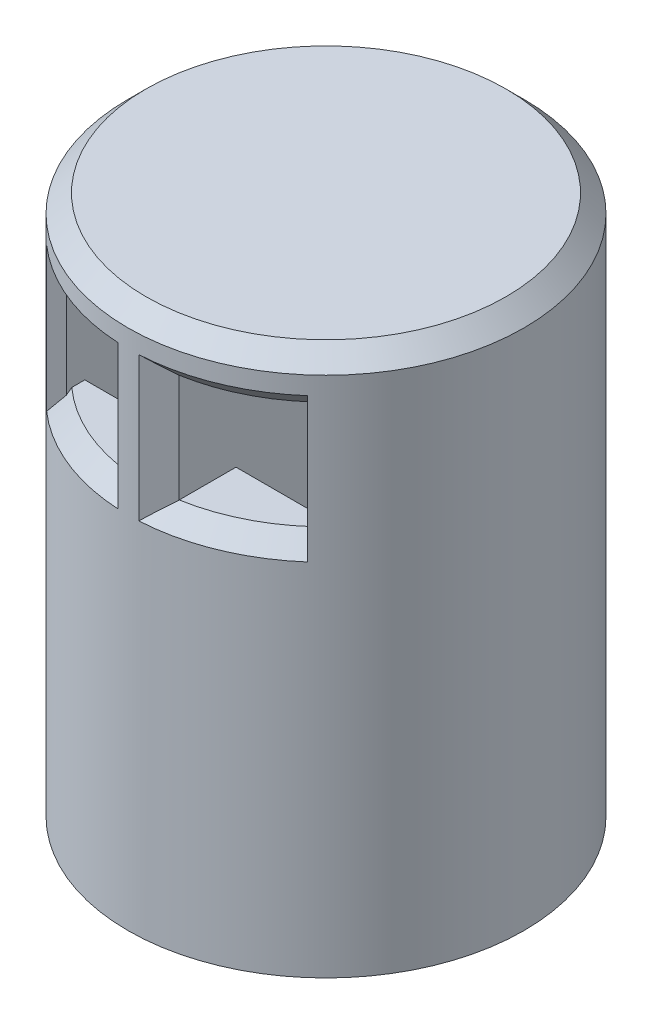
from build123d import *

# Parameters (mm, degrees)
SKETCH1_R           = 5.5
BOSS_EXTRUDE1_DEPTH = 15
SKETCH2_W           = 6.7
SKETCH2_H           = 6.7
CUT_EXTRUDE1_DEPTH  = 3.5
SKETCH3_W           = 2.5
SKETCH3_H           = 6.7
CUT_EXTRUDE2_DEPTH  = 10
SKETCH4_W           = 2.5
SKETCH4_H           = 3
CUT_EXTRUDE3_DEPTH  = 19.263967258
CHAMFER1_SIZE       = 0.5
CHAMFER2_SIZE       = 0.5


with BuildPart() as part:
    # Sketch1 → Boss-Extrude1 (new body)
    with BuildSketch(Plane(origin=(0, 0, 0), x_dir=(1, 0, 0), z_dir=(0, 1, 0))):
        with Locations(Location((0, 0, 0), (0, 0, 270))):
            Circle(SKETCH1_R)
    extrude(amount=BOSS_EXTRUDE1_DEPTH)

    # Sketch2 → Cut-Extrude1 (cut)
    with BuildSketch(Plane.XZ):
        Rectangle(SKETCH2_W, SKETCH2_H)
    extrude(amount=-CUT_EXTRUDE1_DEPTH, mode=Mode.SUBTRACT)

    # Sketch3 → Cut-Extrude2 (cut)
    with BuildSketch(Plane.XZ.offset(-3.5)):
        with Locations((-2.1, 0)):
            Rectangle(SKETCH3_W, SKETCH3_H)
        with Locations((2.1, 0)):
            Rectangle(SKETCH3_W, SKETCH3_H)
    extrude(amount=-CUT_EXTRUDE2_DEPTH, mode=Mode.SUBTRACT)

    # Sketch4 → Cut-Extrude3 (cut, through all)
    with BuildSketch(Plane(origin=(0, 0, 3.35), x_dir=(-1, 0, 0), z_dir=(0, 0, -1))):
        with Locations((2.1, 12)):
            Rectangle(SKETCH4_W, SKETCH4_H)
        with Locations((-2.1, 12)):
            Rectangle(SKETCH4_W, SKETCH4_H)
    extrude(amount=-CUT_EXTRUDE3_DEPTH, mode=Mode.SUBTRACT)

    # Chamfer1
    # the kernel refuses this chamfer: 0.599923048, 0.5, 0.35658472 mm, written as the material it takes off along each edge
    with BuildSketch(Plane(origin=(3.35, 0, -3.35), x_dir=(0, 1, 0), z_dir=(-1, 0, 0)), Plane(origin=(0.85, 3.5, 3.35), x_dir=(-1, 0, 0), z_dir=(0, 0, -1)), Plane(origin=(3.35, 0, 3.35), x_dir=(0, 1, 0), z_dir=(0, 0, -1)), Plane(origin=(-3.35, 0, 3.35), x_dir=(0, 1, 0), z_dir=(1, 0, 0)), Plane(origin=(-3.35, 0, -3.35), x_dir=(0, 1, 0), z_dir=(0, 0, 1))) as chamfer1_piece_1:
        Polygon((CHAMFER1_SIZE, 0), (0, CHAMFER1_SIZE), (0, 0), align=None)
    extrude(amount=6.7, mode=Mode.SUBTRACT)
    with BuildSketch(Plane(origin=(-0.85, 3.5, 3.35), x_dir=(1, 0, 0), z_dir=(0, 0, -1))) as chamfer1_piece_2:
        Polygon((CHAMFER1_SIZE, 0), (0, -CHAMFER1_SIZE), (0, 0), align=None)
    extrude(amount=6.7, mode=Mode.SUBTRACT)
    with BuildSketch(Plane(origin=(-3.35, 13.5, 4.362052269), x_dir=(-0.7730150093099369, 0, -0.6343877326852705), z_dir=(0, -1, 0))) as chamfer1_piece_3:
        with BuildLine():
            Line((0.355264336, 0), (CHAMFER1_SIZE * 0.634387732685, CHAMFER1_SIZE * 0.77301500931))
            Line((CHAMFER1_SIZE * 0.634387732685, CHAMFER1_SIZE * 0.77301500931), (0, 0))
            ThreePointArc((0, 0), (0.17861115, -0.002869133), (0.355264336, 0))
        make_face()
    extrude(amount=3, mode=Mode.SUBTRACT)
    with BuildSketch(Plane(origin=(-0.85, 13.5, 5.433921236), x_dir=(0.9945853784930031, 0, 0.10392268707038738), z_dir=(0, -1, 0))) as chamfer1_piece_4:
        with BuildLine():
            Line((0.561379751, 0), (-CHAMFER1_SIZE * 0.10392268707, -CHAMFER1_SIZE * 0.994585378493))
            Line((-CHAMFER1_SIZE * 0.10392268707, -CHAMFER1_SIZE * 0.994585378493), (0, 0))
            ThreePointArc((0, 0), (0.290009157, 0.007159211), (0.561379751, 0))
        make_face()
    extrude(amount=3, mode=Mode.SUBTRACT)
    with BuildSketch(Plane(origin=(0.85, 13.5, 5.433921236), x_dir=(-0.9945853784930031, 0, 0.10392268707038782), z_dir=(0, -1, 0))) as chamfer1_piece_5:
        with BuildLine():
            Line((0.561379751, 0), (-CHAMFER1_SIZE * 0.10392268707, CHAMFER1_SIZE * 0.994585378493))
            Line((-CHAMFER1_SIZE * 0.10392268707, CHAMFER1_SIZE * 0.994585378493), (0, 0))
            ThreePointArc((0, 0), (0.290009157, -0.007159211), (0.561379751, 0))
        make_face()
    extrude(amount=3, mode=Mode.SUBTRACT)
    with BuildSketch(Plane(origin=(3.35, 13.5, 4.362052269), x_dir=(0.7730150093099386, 0, -0.6343877326852684), z_dir=(0, -1, 0))) as chamfer1_piece_6:
        with BuildLine():
            Line((0.355264336, 0), (CHAMFER1_SIZE * 0.634387732685, -CHAMFER1_SIZE * 0.77301500931))
            Line((CHAMFER1_SIZE * 0.634387732685, -CHAMFER1_SIZE * 0.77301500931), (0, 0))
            ThreePointArc((0, 0), (0.17861115, 0.002869133), (0.355264336, 0))
        make_face()
    extrude(amount=3, mode=Mode.SUBTRACT)
    with BuildSketch(Plane(origin=(4.635841494, 0, -3.35), x_dir=(0, 1, 0), z_dir=(-1, 0, 0))) as chamfer1_piece_7a_section:
        Polygon((CHAMFER1_SIZE, 0), (0, CHAMFER1_SIZE), (0, 0), align=None)
    chamfer1_piece_7a = extrude(amount=7.985841494, mode=Mode.PRIVATE)
    chamfer1_piece_7a = chamfer1_piece_7a & Plane(origin=(0, 0, 0), x_dir=(0, 0, 1), z_dir=(0, -1, 0)) * Cylinder(5.5, 18, mode=Mode.PRIVATE)
    chamfer1_piece_7a = split(chamfer1_piece_7a, bisect_by=Plane(origin=(3.35, 0, -3.35), z_dir=(1, 0, 0)), keep=Keep.TOP, mode=Mode.PRIVATE)
    with BuildSketch(Plane(origin=(3.35, 0, 3.35), x_dir=(0, 1, 0), z_dir=(0, 0, -1))) as chamfer1_piece_7b_section:
        Polygon((CHAMFER1_SIZE, 0), (0, CHAMFER1_SIZE), (0, 0), align=None)
    chamfer1_piece_7b = extrude(amount=7.985841494, mode=Mode.PRIVATE)
    chamfer1_piece_7b = chamfer1_piece_7b & Plane(origin=(0, 0, 0), x_dir=(0, 0, 1), z_dir=(0, -1, 0)) * Cylinder(5.5, 18, mode=Mode.PRIVATE)
    chamfer1_piece_7b = split(chamfer1_piece_7b, bisect_by=Plane(origin=(3.35, 0, -3.35), z_dir=(0, 0, -1)), keep=Keep.TOP, mode=Mode.PRIVATE)
    chamfer1_piece_7 = chamfer1_piece_7a & chamfer1_piece_7b
    add(chamfer1_piece_7, mode=Mode.SUBTRACT)
    with BuildSketch(Plane(origin=(3.35, 0, -3.35), x_dir=(0, 1, 0), z_dir=(-1, 0, 0))) as chamfer1_piece_8a_section:
        Polygon((CHAMFER1_SIZE, 0), (0, CHAMFER1_SIZE), (0, 0), align=None)
    chamfer1_piece_8a = extrude(amount=7.985841494, mode=Mode.PRIVATE)
    chamfer1_piece_8a = chamfer1_piece_8a & Plane(origin=(0, 0, 0), x_dir=(0, 0, 1), z_dir=(0, -1, 0)) * Cylinder(5.5, 18, mode=Mode.PRIVATE)
    chamfer1_piece_8a = split(chamfer1_piece_8a, bisect_by=Plane(origin=(-3.35, 0, -3.35), z_dir=(-1, 0, 0)), keep=Keep.TOP, mode=Mode.PRIVATE)
    with BuildSketch(Plane(origin=(-3.35, 0, -4.635841494), x_dir=(0, 1, 0), z_dir=(0, 0, 1))) as chamfer1_piece_8b_section:
        Polygon((CHAMFER1_SIZE, 0), (0, CHAMFER1_SIZE), (0, 0), align=None)
    chamfer1_piece_8b = extrude(amount=7.985841494, mode=Mode.PRIVATE)
    chamfer1_piece_8b = chamfer1_piece_8b & Plane(origin=(0, 0, 0), x_dir=(0, 0, 1), z_dir=(0, -1, 0)) * Cylinder(5.5, 18, mode=Mode.PRIVATE)
    chamfer1_piece_8b = split(chamfer1_piece_8b, bisect_by=Plane(origin=(-3.35, 0, -3.35), z_dir=(0, 0, -1)), keep=Keep.TOP, mode=Mode.PRIVATE)
    chamfer1_piece_8 = chamfer1_piece_8a & chamfer1_piece_8b
    add(chamfer1_piece_8, mode=Mode.SUBTRACT)
    with BuildSketch(Plane(origin=(-3.35, 0, 3.35), x_dir=(0, 1, 0), z_dir=(1, 0, 0))) as chamfer1_piece_9a_section:
        Polygon((CHAMFER1_SIZE, 0), (0, CHAMFER1_SIZE), (0, 0), align=None)
    chamfer1_piece_9a = extrude(amount=7.985841494, mode=Mode.PRIVATE)
    chamfer1_piece_9a = chamfer1_piece_9a & Plane(origin=(0, 0, 0), x_dir=(0, 0, 1), z_dir=(0, -1, 0)) * Cylinder(5.5, 18, mode=Mode.PRIVATE)
    chamfer1_piece_9a = split(chamfer1_piece_9a, bisect_by=Plane(origin=(3.35, 0, 3.35), z_dir=(1, 0, 0)), keep=Keep.TOP, mode=Mode.PRIVATE)
    with BuildSketch(Plane(origin=(3.35, 0, 4.635841494), x_dir=(0, 1, 0), z_dir=(0, 0, -1))) as chamfer1_piece_9b_section:
        Polygon((CHAMFER1_SIZE, 0), (0, CHAMFER1_SIZE), (0, 0), align=None)
    chamfer1_piece_9b = extrude(amount=7.985841494, mode=Mode.PRIVATE)
    chamfer1_piece_9b = chamfer1_piece_9b & Plane(origin=(0, 0, 0), x_dir=(0, 0, 1), z_dir=(0, -1, 0)) * Cylinder(5.5, 18, mode=Mode.PRIVATE)
    chamfer1_piece_9b = split(chamfer1_piece_9b, bisect_by=Plane(origin=(3.35, 0, 3.35), z_dir=(0, 0, 1)), keep=Keep.TOP, mode=Mode.PRIVATE)
    chamfer1_piece_9 = chamfer1_piece_9a & chamfer1_piece_9b
    add(chamfer1_piece_9, mode=Mode.SUBTRACT)
    with BuildSketch(Plane(origin=(-4.635841494, 0, 3.35), x_dir=(0, 1, 0), z_dir=(1, 0, 0))) as chamfer1_piece_10a_section:
        Polygon((CHAMFER1_SIZE, 0), (0, CHAMFER1_SIZE), (0, 0), align=None)
    chamfer1_piece_10a = extrude(amount=7.985841494, mode=Mode.PRIVATE)
    chamfer1_piece_10a = chamfer1_piece_10a & Plane(origin=(0, 0, 0), x_dir=(0, 0, 1), z_dir=(0, -1, 0)) * Cylinder(5.5, 18, mode=Mode.PRIVATE)
    chamfer1_piece_10a = split(chamfer1_piece_10a, bisect_by=Plane(origin=(-3.35, 0, 3.35), z_dir=(-1, 0, 0)), keep=Keep.TOP, mode=Mode.PRIVATE)
    with BuildSketch(Plane(origin=(-3.35, 0, -3.35), x_dir=(0, 1, 0), z_dir=(0, 0, 1))) as chamfer1_piece_10b_section:
        Polygon((CHAMFER1_SIZE, 0), (0, CHAMFER1_SIZE), (0, 0), align=None)
    chamfer1_piece_10b = extrude(amount=7.985841494, mode=Mode.PRIVATE)
    chamfer1_piece_10b = chamfer1_piece_10b & Plane(origin=(0, 0, 0), x_dir=(0, 0, 1), z_dir=(0, -1, 0)) * Cylinder(5.5, 18, mode=Mode.PRIVATE)
    chamfer1_piece_10b = split(chamfer1_piece_10b, bisect_by=Plane(origin=(-3.35, 0, 3.35), z_dir=(0, 0, 1)), keep=Keep.TOP, mode=Mode.PRIVATE)
    chamfer1_piece_10 = chamfer1_piece_10a & chamfer1_piece_10b
    add(chamfer1_piece_10, mode=Mode.SUBTRACT)
    # the kernel refuses this chamfer: 0.599923048, 0.5, 0.35658472 mm, written as the material it takes off along each edge
    with BuildSketch(Plane(origin=(0, 10.5, 0), x_dir=(0.17976967386788098, 0, 0.9837087294303308), z_dir=(0.9837087294303308, 0, -0.17976967386788098))) as chamfer1_2_piece_1_section:
        Polygon((5.5, CHAMFER1_SIZE), (5.5 - CHAMFER1_SIZE, 0), (5.5, 0), align=None)
    chamfer1_2_piece_1 = revolve(axis=Axis((0, 10.5, 0), (0, -1, 0)), revolution_arc=64.977834745, mode=Mode.PRIVATE)
    chamfer1_2_piece_1 = split(chamfer1_2_piece_1, bisect_by=Plane(origin=(2.891960618, 10.5, 2.891960618), z_dir=(0.707106781186547, 0, 0.7071067811865481)), keep=Keep.TOP, mode=Mode.PRIVATE)
    add(chamfer1_2_piece_1, mode=Mode.SUBTRACT)
    with BuildSketch(Plane(origin=(0, 10.5, 0), x_dir=(0.17976967386788098, 0, 0.9837087294303308), z_dir=(0.9837087294303308, 0, -0.17976967386788098))) as chamfer1_2_piece_2_section:
        Polygon((5.5, CHAMFER1_SIZE), (5.5 - CHAMFER1_SIZE, 0), (5.5, 0), align=None)
    chamfer1_2_piece_2 = revolve(axis=Axis((0, 10.5, 0), (0, -1, 0)), revolution_arc=64.977834745, mode=Mode.PRIVATE)
    chamfer1_2_piece_2 = split(chamfer1_2_piece_2, bisect_by=Plane(origin=(0.85, 10.5, 0), z_dir=(1, 0, 0)), keep=Keep.TOP, mode=Mode.PRIVATE)
    add(chamfer1_2_piece_2, mode=Mode.SUBTRACT)
    with BuildSketch(Plane(origin=(0, 10.5, 0), x_dir=(0.17976967386788098, 0, 0.9837087294303308), z_dir=(0.9837087294303308, 0, -0.17976967386788098))) as chamfer1_2_piece_3_section:
        Polygon((5.5, CHAMFER1_SIZE), (5.5 - CHAMFER1_SIZE, 0), (5.5, 0), align=None)
    chamfer1_2_piece_3 = revolve(axis=Axis((0, 10.5, 0), (0, -1, 0)), revolution_arc=64.977834745, mode=Mode.PRIVATE)
    chamfer1_2_piece_3 = split(chamfer1_2_piece_3, bisect_by=Plane(origin=(-0.85, 10.5, 0), z_dir=(-1, 0, 0)), keep=Keep.TOP, mode=Mode.PRIVATE)
    chamfer1_2_piece_3 = split(chamfer1_2_piece_3, bisect_by=Plane(origin=(0.256026135, 10.5, 0.256026135), z_dir=(0.7071067811865424, 0, 0.7071067811865527)), keep=Keep.TOP, mode=Mode.PRIVATE)
    add(chamfer1_2_piece_3, mode=Mode.SUBTRACT)
    with BuildSketch(Plane(origin=(0, 10.5, 0), x_dir=(0.17976967386788098, 0, 0.9837087294303308), z_dir=(0.9837087294303308, 0, -0.17976967386788098))) as chamfer1_2_piece_4_section:
        Polygon((5.5, CHAMFER1_SIZE), (5.5 - CHAMFER1_SIZE, 0), (5.5, 0), align=None)
    chamfer1_2_piece_4 = revolve(axis=Axis((0, 10.5, 0), (0, -1, 0)), revolution_arc=64.977834745, mode=Mode.PRIVATE)
    chamfer1_2_piece_4 = split(chamfer1_2_piece_4, bisect_by=Plane(origin=(-3.35, 10.5, 0), z_dir=(1, 0, 0)), keep=Keep.TOP, mode=Mode.PRIVATE)
    chamfer1_2_piece_4 = split(chamfer1_2_piece_4, bisect_by=Plane(origin=(-2.891960618, 10.5, 2.891960618), z_dir=(-0.7071067811865455, 0, 0.7071067811865496)), keep=Keep.TOP, mode=Mode.PRIVATE)
    add(chamfer1_2_piece_4, mode=Mode.SUBTRACT)
    with BuildSketch(Plane(origin=(0, 13.5, 0), x_dir=(-0.8153450150908111, 0, 0.57897539357607), z_dir=(-0.57897539357607, 0, -0.8153450150908111))) as chamfer1_2_piece_5_section:
        Polygon((5.5, CHAMFER1_SIZE), (5.5 - CHAMFER1_SIZE, 0), (5.5, 0), align=None)
    chamfer1_2_piece_5 = revolve(axis=Axis((0, 13.5, 0), (0, 1, 0)), revolution_arc=64.977834745, mode=Mode.PRIVATE)
    chamfer1_2_piece_5 = split(chamfer1_2_piece_5, bisect_by=Plane(origin=(-3.35, 13.5, 0), z_dir=(1, 0, 0)), keep=Keep.TOP, mode=Mode.PRIVATE)
    chamfer1_2_piece_5 = split(chamfer1_2_piece_5, bisect_by=Plane(origin=(-2.891960618, 13.5, 2.891960618), z_dir=(-0.7071067811865455, 0, 0.7071067811865496)), keep=Keep.TOP, mode=Mode.PRIVATE)
    add(chamfer1_2_piece_5, mode=Mode.SUBTRACT)
    with BuildSketch(Plane(origin=(0, 13.5, 0), x_dir=(-0.8153450150908111, 0, 0.57897539357607), z_dir=(-0.57897539357607, 0, -0.8153450150908111))) as chamfer1_2_piece_6_section:
        Polygon((5.5, CHAMFER1_SIZE), (5.5 - CHAMFER1_SIZE, 0), (5.5, 0), align=None)
    chamfer1_2_piece_6 = revolve(axis=Axis((0, 13.5, 0), (0, 1, 0)), revolution_arc=64.977834745, mode=Mode.PRIVATE)
    chamfer1_2_piece_6 = split(chamfer1_2_piece_6, bisect_by=Plane(origin=(-0.85, 13.5, 0), z_dir=(-1, 0, 0)), keep=Keep.TOP, mode=Mode.PRIVATE)
    chamfer1_2_piece_6 = split(chamfer1_2_piece_6, bisect_by=Plane(origin=(0.256026135, 13.5, 0.256026135), z_dir=(0.7071067811865424, 0, 0.7071067811865527)), keep=Keep.TOP, mode=Mode.PRIVATE)
    add(chamfer1_2_piece_6, mode=Mode.SUBTRACT)
    with BuildSketch(Plane(origin=(0, 13.5, 0), x_dir=(-0.8153450150908111, 0, 0.57897539357607), z_dir=(-0.57897539357607, 0, -0.8153450150908111))) as chamfer1_2_piece_7_section:
        Polygon((5.5, CHAMFER1_SIZE), (5.5 - CHAMFER1_SIZE, 0), (5.5, 0), align=None)
    chamfer1_2_piece_7 = revolve(axis=Axis((0, 13.5, 0), (0, 1, 0)), revolution_arc=64.977834745, mode=Mode.PRIVATE)
    chamfer1_2_piece_7 = split(chamfer1_2_piece_7, bisect_by=Plane(origin=(0.85, 13.5, 0), z_dir=(1, 0, 0)), keep=Keep.TOP, mode=Mode.PRIVATE)
    add(chamfer1_2_piece_7, mode=Mode.SUBTRACT)
    with BuildSketch(Plane(origin=(0, 13.5, 0), x_dir=(-0.8153450150908111, 0, 0.57897539357607), z_dir=(-0.57897539357607, 0, -0.8153450150908111))) as chamfer1_2_piece_8_section:
        Polygon((5.5, CHAMFER1_SIZE), (5.5 - CHAMFER1_SIZE, 0), (5.5, 0), align=None)
    chamfer1_2_piece_8 = revolve(axis=Axis((0, 13.5, 0), (0, 1, 0)), revolution_arc=64.977834745, mode=Mode.PRIVATE)
    chamfer1_2_piece_8 = split(chamfer1_2_piece_8, bisect_by=Plane(origin=(2.891960618, 13.5, 2.891960618), z_dir=(0.707106781186547, 0, 0.7071067811865481)), keep=Keep.TOP, mode=Mode.PRIVATE)
    add(chamfer1_2_piece_8, mode=Mode.SUBTRACT)
    with BuildSketch(Plane(origin=(0, 13.5, 0), x_dir=(-0.17976967386788484, 0, 0.98370872943033), z_dir=(-0.98370872943033, 0, -0.17976967386788484))) as chamfer1_2_piece_9_section:
        Polygon((5.5, CHAMFER1_SIZE), (5.5 - CHAMFER1_SIZE, 0), (5.5, 0), align=None)
    chamfer1_2_piece_9 = revolve(axis=Axis((0, 13.5, 0), (0, 1, 0)), revolution_arc=64.977834745, mode=Mode.PRIVATE)
    chamfer1_2_piece_9 = split(chamfer1_2_piece_9, bisect_by=Plane(origin=(-2.891960618, 13.5, 2.891960618), z_dir=(-0.7071067811865455, 0, 0.7071067811865496)), keep=Keep.TOP, mode=Mode.PRIVATE)
    add(chamfer1_2_piece_9, mode=Mode.SUBTRACT)
    with BuildSketch(Plane(origin=(0, 13.5, 0), x_dir=(-0.17976967386788484, 0, 0.98370872943033), z_dir=(-0.98370872943033, 0, -0.17976967386788484))) as chamfer1_2_piece_10_section:
        Polygon((5.5, CHAMFER1_SIZE), (5.5 - CHAMFER1_SIZE, 0), (5.5, 0), align=None)
    chamfer1_2_piece_10 = revolve(axis=Axis((0, 13.5, 0), (0, 1, 0)), revolution_arc=64.977834745, mode=Mode.PRIVATE)
    chamfer1_2_piece_10 = split(chamfer1_2_piece_10, bisect_by=Plane(origin=(-0.85, 13.5, 0), z_dir=(-1, 0, 0)), keep=Keep.TOP, mode=Mode.PRIVATE)
    add(chamfer1_2_piece_10, mode=Mode.SUBTRACT)
    with BuildSketch(Plane(origin=(0, 13.5, 0), x_dir=(-0.17976967386788484, 0, 0.98370872943033), z_dir=(-0.98370872943033, 0, -0.17976967386788484))) as chamfer1_2_piece_11_section:
        Polygon((5.5, CHAMFER1_SIZE), (5.5 - CHAMFER1_SIZE, 0), (5.5, 0), align=None)
    chamfer1_2_piece_11 = revolve(axis=Axis((0, 13.5, 0), (0, 1, 0)), revolution_arc=64.977834745, mode=Mode.PRIVATE)
    chamfer1_2_piece_11 = split(chamfer1_2_piece_11, bisect_by=Plane(origin=(0.85, 13.5, 0), z_dir=(1, 0, 0)), keep=Keep.TOP, mode=Mode.PRIVATE)
    chamfer1_2_piece_11 = split(chamfer1_2_piece_11, bisect_by=Plane(origin=(-0.256026135, 13.5, 0.256026135), z_dir=(-0.7071067811865516, 0, 0.7071067811865436)), keep=Keep.TOP, mode=Mode.PRIVATE)
    add(chamfer1_2_piece_11, mode=Mode.SUBTRACT)
    with BuildSketch(Plane(origin=(0, 13.5, 0), x_dir=(-0.17976967386788484, 0, 0.98370872943033), z_dir=(-0.98370872943033, 0, -0.17976967386788484))) as chamfer1_2_piece_12_section:
        Polygon((5.5, CHAMFER1_SIZE), (5.5 - CHAMFER1_SIZE, 0), (5.5, 0), align=None)
    chamfer1_2_piece_12 = revolve(axis=Axis((0, 13.5, 0), (0, 1, 0)), revolution_arc=64.977834745, mode=Mode.PRIVATE)
    chamfer1_2_piece_12 = split(chamfer1_2_piece_12, bisect_by=Plane(origin=(3.35, 13.5, 0), z_dir=(-1, 0, 0)), keep=Keep.TOP, mode=Mode.PRIVATE)
    chamfer1_2_piece_12 = split(chamfer1_2_piece_12, bisect_by=Plane(origin=(2.891960618, 13.5, 2.891960618), z_dir=(0.707106781186547, 0, 0.7071067811865481)), keep=Keep.TOP, mode=Mode.PRIVATE)
    add(chamfer1_2_piece_12, mode=Mode.SUBTRACT)
    with BuildSketch(Plane(origin=(0, 10.5, 0), x_dir=(0.8153450150908462, 0, 0.5789753935760206), z_dir=(0.5789753935760206, 0, -0.8153450150908462))) as chamfer1_2_piece_13_section:
        Polygon((5.5, CHAMFER1_SIZE), (5.5 - CHAMFER1_SIZE, 0), (5.5, 0), align=None)
    chamfer1_2_piece_13 = revolve(axis=Axis((0, 10.5, 0), (0, -1, 0)), revolution_arc=64.977834745, mode=Mode.PRIVATE)
    chamfer1_2_piece_13 = split(chamfer1_2_piece_13, bisect_by=Plane(origin=(3.35, 10.5, 0), z_dir=(-1, 0, 0)), keep=Keep.TOP, mode=Mode.PRIVATE)
    chamfer1_2_piece_13 = split(chamfer1_2_piece_13, bisect_by=Plane(origin=(2.891960618, 10.5, 2.891960618), z_dir=(0.707106781186547, 0, 0.7071067811865481)), keep=Keep.TOP, mode=Mode.PRIVATE)
    add(chamfer1_2_piece_13, mode=Mode.SUBTRACT)
    with BuildSketch(Plane(origin=(0, 10.5, 0), x_dir=(0.8153450150908462, 0, 0.5789753935760206), z_dir=(0.5789753935760206, 0, -0.8153450150908462))) as chamfer1_2_piece_14_section:
        Polygon((5.5, CHAMFER1_SIZE), (5.5 - CHAMFER1_SIZE, 0), (5.5, 0), align=None)
    chamfer1_2_piece_14 = revolve(axis=Axis((0, 10.5, 0), (0, -1, 0)), revolution_arc=64.977834745, mode=Mode.PRIVATE)
    chamfer1_2_piece_14 = split(chamfer1_2_piece_14, bisect_by=Plane(origin=(0.85, 10.5, 0), z_dir=(1, 0, 0)), keep=Keep.TOP, mode=Mode.PRIVATE)
    chamfer1_2_piece_14 = split(chamfer1_2_piece_14, bisect_by=Plane(origin=(-0.256026135, 10.5, 0.256026135), z_dir=(-0.7071067811865516, 0, 0.7071067811865436)), keep=Keep.TOP, mode=Mode.PRIVATE)
    add(chamfer1_2_piece_14, mode=Mode.SUBTRACT)
    with BuildSketch(Plane(origin=(0, 10.5, 0), x_dir=(0.8153450150908462, 0, 0.5789753935760206), z_dir=(0.5789753935760206, 0, -0.8153450150908462))) as chamfer1_2_piece_15_section:
        Polygon((5.5, CHAMFER1_SIZE), (5.5 - CHAMFER1_SIZE, 0), (5.5, 0), align=None)
    chamfer1_2_piece_15 = revolve(axis=Axis((0, 10.5, 0), (0, -1, 0)), revolution_arc=64.977834745, mode=Mode.PRIVATE)
    chamfer1_2_piece_15 = split(chamfer1_2_piece_15, bisect_by=Plane(origin=(-0.85, 10.5, 0), z_dir=(-1, 0, 0)), keep=Keep.TOP, mode=Mode.PRIVATE)
    add(chamfer1_2_piece_15, mode=Mode.SUBTRACT)
    with BuildSketch(Plane(origin=(0, 10.5, 0), x_dir=(0.8153450150908462, 0, 0.5789753935760206), z_dir=(0.5789753935760206, 0, -0.8153450150908462))) as chamfer1_2_piece_16_section:
        Polygon((5.5, CHAMFER1_SIZE), (5.5 - CHAMFER1_SIZE, 0), (5.5, 0), align=None)
    chamfer1_2_piece_16 = revolve(axis=Axis((0, 10.5, 0), (0, -1, 0)), revolution_arc=64.977834745, mode=Mode.PRIVATE)
    chamfer1_2_piece_16 = split(chamfer1_2_piece_16, bisect_by=Plane(origin=(-2.891960618, 10.5, 2.891960618), z_dir=(-0.7071067811865455, 0, 0.7071067811865496)), keep=Keep.TOP, mode=Mode.PRIVATE)
    add(chamfer1_2_piece_16, mode=Mode.SUBTRACT)

    # Chamfer2
    chamfer2_edges = [part.edges().sort_by_distance(p)[0] for p in [
        (0, 15, -5.5),
    ]]
    chamfer(chamfer2_edges, length=CHAMFER2_SIZE)


solid = part.part
